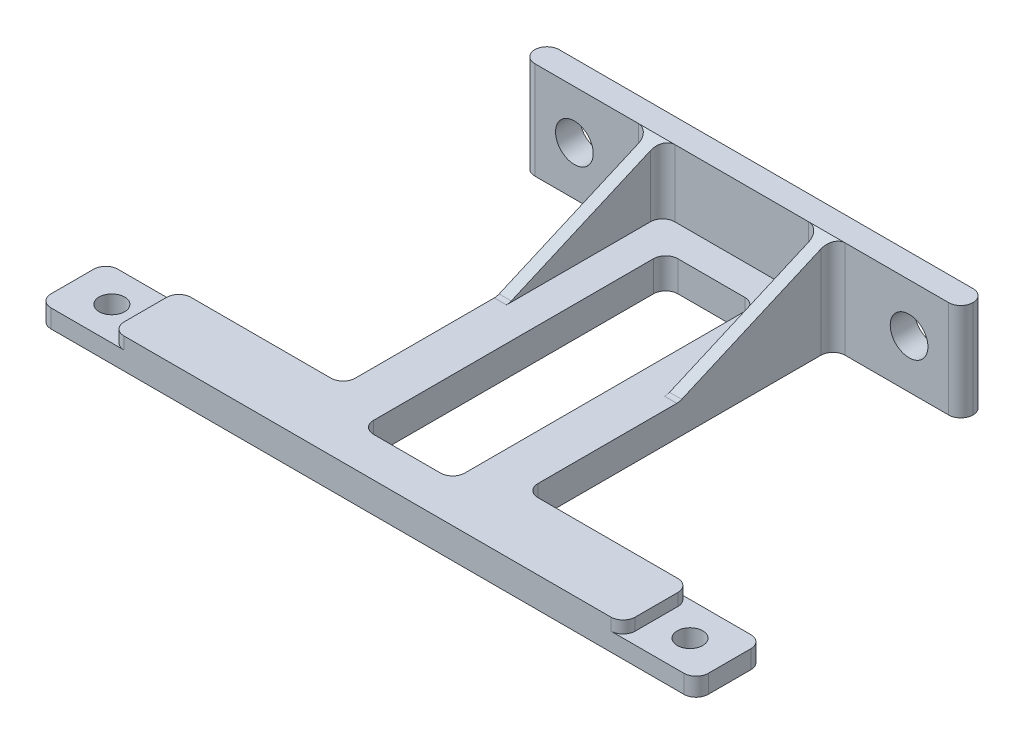
from build123d import *

# Parameters (mm, degrees)
SKETCH_1_W          = 72
SKETCH_1_H          = 16
SKETCH_1_R          = 3.1
EXTRUDE_1_DEPTH     = 4
EXTRUDE_START       = -4
SKETCH_3_W          = 30
SKETCH_3_H          = 5
EXTRUDE_2_DEPTH     = 60
SKETCH_5_W          = 108
SKETCH_5_H          = 11
SKETCH_5_R          = 2.1
EXTRUDE_3_DEPTH     = 5
SKETCH_6_W          = 12
SKETCH_6_H          = 11
CUT_EXTRUDE_1_DEPTH = 2
SKETCH_7_W          = 15
SKETCH_7_H          = 50
CUT_EXTRUDE_2_DEPTH = 86.599357474
EXTRUDE_4_DEPTH     = 2
EXTRUDE_START_2     = -30
EXTRUDE_5_DEPTH     = 2
FILLET_1_R          = 2


with BuildPart() as part:
    # 草图1 → 凸台-拉伸1 (new body)
    with BuildSketch(Plane.XY):
        Rectangle(SKETCH_1_W, SKETCH_1_H)
        with Locations((-27.5, 0)):
            Circle(SKETCH_1_R, mode=Mode.SUBTRACT)
        with Locations(Location((27.5, 0, 0), (0, 0, 180))):
            Circle(SKETCH_1_R, mode=Mode.SUBTRACT)
    extrude(amount=EXTRUDE_1_DEPTH)

    # 草图3 → 凸台-拉伸2 (add)
    with BuildSketch(Plane.XY.offset(4).offset(EXTRUDE_START)):
        with Locations((0, -5.5)):
            Rectangle(SKETCH_3_W, SKETCH_3_H)
    extrude(amount=EXTRUDE_2_DEPTH)

    # 草图5 → 凸台-拉伸3 (add, through all)
    with BuildSketch(Plane(origin=(0, -3, 0), x_dir=(1, 0, 0), z_dir=(0, 1, 0))):
        with Locations((0, -60)):
            Rectangle(SKETCH_5_W, SKETCH_5_H)
        with Locations(Location((47.5, -60, 0), (0, 0, 270))):
            Circle(SKETCH_5_R, mode=Mode.SUBTRACT)
        with Locations(Location((-47.5, -60, 0), (0, 0, 90))):
            Circle(SKETCH_5_R, mode=Mode.SUBTRACT)
    extrude(amount=-EXTRUDE_3_DEPTH)

    # 草图6 → 切除-拉伸1 (cut)
    with BuildSketch(Plane(origin=(0, -3, 0), x_dir=(1, 0, 0), z_dir=(0, 1, 0))):
        with Locations((-48, -60)):
            Rectangle(SKETCH_6_W, SKETCH_6_H)
        with Locations((48, -60)):
            Rectangle(SKETCH_6_W, SKETCH_6_H)
    extrude(amount=-CUT_EXTRUDE_1_DEPTH, mode=Mode.SUBTRACT)

    # 草图7 → 切除-拉伸2 (cut, through all)
    with BuildSketch(Plane(origin=(0, -3, 0), x_dir=(1, 0, 0), z_dir=(0, 1, 0))):
        with Locations((0, -34)):
            Rectangle(SKETCH_7_W, SKETCH_7_H)
    extrude(amount=-CUT_EXTRUDE_2_DEPTH, mode=Mode.SUBTRACT)

    # 草图8 → 凸台-拉伸4 (add)
    with BuildSketch(Plane.ZY.offset(15)):
        Polygon((4, -3), (29.25, -3), (4, 8), align=None)
    extrude(amount=-EXTRUDE_4_DEPTH)

    # 草图8<2> → 凸台-拉伸5 (add)
    with BuildSketch(Plane.ZY.offset(15).offset(EXTRUDE_START_2)):
        Polygon((4, -3), (29.25, -3), (4, 8), align=None)
    extrude(amount=EXTRUDE_5_DEPTH)

    # 圆角1
    fillet_1_edges = [part.edges().sort_by_distance(p)[0] for p in [
        (15, 0, 4),
        (36, 0, 4),
        (36, 0, 0),
        (-36, 0, 0),
        (-36, 0, 4),
        (-15, -5.5, 54.5),
        (-54, -6.5, 54.5),
        (-54, -6.5, 65.5),
        (54, -6.5, 65.5),
        (54, -6.5, 54.5),
        (15, -5.5, 54.5),
        (-15, 0, 4),
        (-42, -4, 54.5),
        (42, -4, 54.5),
        (42, -4, 65.5),
        (-42, -4, 65.5),
        (-7.5, -5.5, 59),
        (-7.5, -5.5, 9),
        (7.5, -5.5, 59),
        (7.5, -5.5, 9),
        (14, -3, 29.25),
        (-14, -3, 29.25),
        (-13, 2.5, 4),
        (13, 2.5, 4),
    ]]
    fillet(fillet_1_edges, radius=FILLET_1_R - 0.0001)  # a hair under: the kernel refuses the full size


solid = part.part
